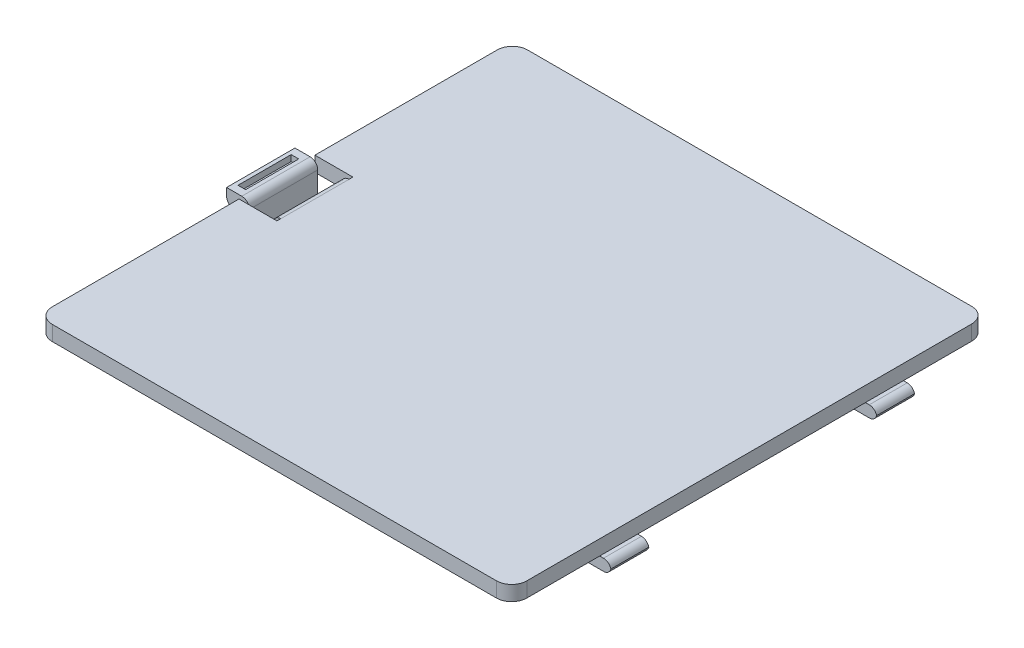
from build123d import *

# Parameters (mm, degrees)
BOSS_EXTRUDE1_DEPTH  = 5
SKETCH8_W            = 12.7
SKETCH8_H            = 25.4
CUT_EXTRUDE1_DEPTH   = 12.7
BOSS_EXTRUDE6_START  = 1.27
BOSS_EXTRUDE6_DEPTH  = 22.86
FILLET3_R            = 2.54
SKETCH12_W           = 22.86
SKETCH12_H           = 5.08
BOSS_EXTRUDE7_DEPTH  = 5.08
FILLET8_R            = 2.54
SKETCH13_W           = 2.54
SKETCH13_H           = 17.78
CUT_EXTRUDE2_DEPTH   = 2.032
BOSS_EXTRUDE8_DEPTH  = 22.86
FILLET5_R            = 2.54
FILLET6_R            = 2.54
BOSS_EXTRUDE9_START  = -27.94
SKETCH15_W           = 10.16
SKETCH15_H           = 3.81
BOSS_EXTRUDE9_DEPTH  = 12.7
BOSS_EXTRUDE10_START = -116.84
SKETCH15_2_W         = 10.16
SKETCH15_2_H         = 3.81
BOSS_EXTRUDE10_DEPTH = 12.7
FILLET7_R            = 2.54


with BuildPart() as part:
    # Sketch2 → Boss-Extrude1 (new body)
    with BuildSketch(Plane(origin=(0, 0, 0), x_dir=(1, 0, 0), z_dir=(0, 1, 0))):
        with BuildLine():
            Line((-98.109845206, -87.510053172), (50.472154842, -87.510053172))
            ThreePointArc((50.472154842, -87.510053172), (54.064257291, -86.02215562), (55.552154842, -82.430053172))
            Line((55.552154842, -82.430053172), (55.552154842, 66.389946828))
            ThreePointArc((55.552154842, 66.389946828), (54.064257291, 69.982049277), (50.472154842, 71.469946828))
            Line((50.472154842, 71.469946828), (-98.109845206, 71.469946828))
            ThreePointArc((-98.109845206, 71.469946828), (-101.701947654, 69.982049277), (-103.189845206, 66.389946828))
            Line((-103.189845206, 66.389946828), (-103.189845206, -82.430053172))
            ThreePointArc((-103.189845206, -82.430053172), (-101.701947654, -86.02215562), (-98.109845206, -87.510053172))
        make_face()
    extrude(amount=BOSS_EXTRUDE1_DEPTH)

    # Sketch8 → Cut-Extrude1 (cut)
    with BuildSketch(Plane(origin=(0, 5, 0), x_dir=(1, 0, 0), z_dir=(0, 1, 0))):
        with Locations((-96.839845206, -7.270053172)):
            Rectangle(SKETCH8_W, SKETCH8_H)
    extrude(amount=-CUT_EXTRUDE1_DEPTH, mode=Mode.SUBTRACT)

    # Sketch9 → Boss-Extrude6 (add)
    with BuildSketch(Plane(origin=(0, 0, 19.970053172), x_dir=(-1, 0, 0), z_dir=(0, 0, -1)).offset(BOSS_EXTRUDE6_START)):
        with BuildLine():
            Line((90.489845206, 5), (90.489845206, -9.510091846))
            ThreePointArc((90.489845206, -9.510091846), (91.233793982, -11.30614307), (93.029845206, -12.050091846))
            Line((93.029845206, -12.050091846), (100.984663509, -12.050091846))
            ThreePointArc((100.984663509, -12.050091846), (102.780714734, -11.30614307), (103.524663509, -9.510091846))
            Line((103.524663509, -9.510091846), (103.524663509, 5))
            Line((103.524663509, 5), (100.984663509, 5))
            Line((100.984663509, 5), (100.984663509, -6.970091846))
            ThreePointArc((100.984663509, -6.970091846), (100.240714734, -8.76614307), (98.444663509, -9.510091846))
            Line((98.444663509, -9.510091846), (95.569845206, -9.510091846))
            ThreePointArc((95.569845206, -9.510091846), (93.773793982, -8.76614307), (93.029845206, -6.970091846))
            Line((93.029845206, -6.970091846), (93.029845206, 5))
            Line((93.029845206, 5), (90.489845206, 5))
        make_face()
    extrude(amount=BOSS_EXTRUDE6_DEPTH)

    # Fillet3
    fillet3_edges = [part.edges().sort_by_distance(p)[0] for p in [
        (-90.489845206, 0, 7.270053172),
    ]]
    fillet(fillet3_edges, radius=FILLET3_R)

    # Sketch12 → Boss-Extrude7 (add)
    with BuildSketch(Plane.ZY.offset(103.524663509)):
        with Locations((7.270053172, 2.46)):
            Rectangle(SKETCH12_W, SKETCH12_H)
    extrude(amount=BOSS_EXTRUDE7_DEPTH)

    # Fillet8
    fillet8_edges = [part.edges().sort_by_distance(p)[0] for p in [
        (-100.984663509, 5, 7.270053172),
    ]]
    fillet(fillet8_edges, radius=FILLET8_R)

    # Sketch13 → Cut-Extrude2 (cut)
    with BuildSketch(Plane(origin=(0, 5, 0), x_dir=(1, 0, 0), z_dir=(0, 1, 0))):
        with Locations((-106.064663509, -7.270053172)):
            Rectangle(SKETCH13_W, SKETCH13_H)
    extrude(amount=-CUT_EXTRUDE2_DEPTH, mode=Mode.SUBTRACT)

    # Sketch14 → Boss-Extrude8 (add)
    with BuildSketch(Plane(origin=(0, 0, -4.159946828), x_dir=(-1, 0, 0), z_dir=(0, 0, -1))):
        Polygon((103.524663509, -4.576775108), (105.048663509, -4.576775108), (103.524663509, -7.370775108), align=None)
    extrude(amount=-BOSS_EXTRUDE8_DEPTH)

    # Fillet5
    fillet5_edges = [part.edges().sort_by_distance(p)[0] for p in [
        (-93.029845206, 5, 7.270053172),
    ]]
    fillet(fillet5_edges, radius=FILLET5_R)

    # Fillet6
    fillet6_edges = [part.edges().sort_by_distance(p)[0] for p in [
        (-108.604663509, -0.08, 7.270053172),
    ]]
    fillet(fillet6_edges, radius=FILLET6_R)

    # Sketch15 → Boss-Extrude9 (add)
    with BuildSketch(Plane(origin=(0, 0, -71.469946828), x_dir=(-1, 0, 0), z_dir=(0, 0, -1)).offset(BOSS_EXTRUDE9_START)):
        with Locations((-54.290154794, -1.905)):
            Rectangle(SKETCH15_W, SKETCH15_H)
    extrude(amount=-BOSS_EXTRUDE9_DEPTH)

    # Sketch15<2> → Boss-Extrude10 (add)
    with BuildSketch(Plane(origin=(0, 0, -71.469946828), x_dir=(-1, 0, 0), z_dir=(0, 0, -1)).offset(BOSS_EXTRUDE10_START)):
        with Locations((-54.290154794, -1.905)):
            Rectangle(SKETCH15_2_W, SKETCH15_2_H)
    extrude(amount=-BOSS_EXTRUDE10_DEPTH)

    # Fillet7
    # the kernel refuses this fillet: 2.54 mm, written as the material it adds along each edge
    with BuildSketch(Plane(origin=(49.210154794, 0, 45.370053172), x_dir=(-1, 0, 0), z_dir=(0, 0, 1)), Plane(origin=(49.210154794, 0, -43.529946828), x_dir=(-1, 0, 0), z_dir=(0, 0, 1))) as fillet7_piece_1:
        with BuildLine():
            CenterArc((FILLET7_R, FILLET7_R), FILLET7_R, 180, 90)
            Line((0, FILLET7_R), (0, 0))
            Line((0, 0), (FILLET7_R, 0))
        make_face()
    extrude(amount=12.7)
    # the kernel refuses this fillet: 2.54 mm, written as the material it takes off along each edge
    with BuildSketch(Plane(origin=(59.370154794, 0, 39.020053172), x_dir=(-1, 0, 0), z_dir=(0, 0, 1)), Plane(origin=(59.370154794, -3.81, 39.020053172), x_dir=(0, 1, 0), z_dir=(0, 0, 1)), Plane(origin=(59.370154794, -3.81, -49.879946828), x_dir=(0, 1, 0), z_dir=(0, 0, 1)), Plane(origin=(59.370154794, 0, -49.879946828), x_dir=(-1, 0, 0), z_dir=(0, 0, 1))) as fillet7_2_piece_1:
        with BuildLine():
            CenterArc((FILLET7_R, FILLET7_R), FILLET7_R, 180, 90)
            Line((0, FILLET7_R), (0, 0))
            Line((0, 0), (FILLET7_R, 0))
        make_face()
    extrude(amount=25.4, mode=Mode.SUBTRACT)


solid = part.part
